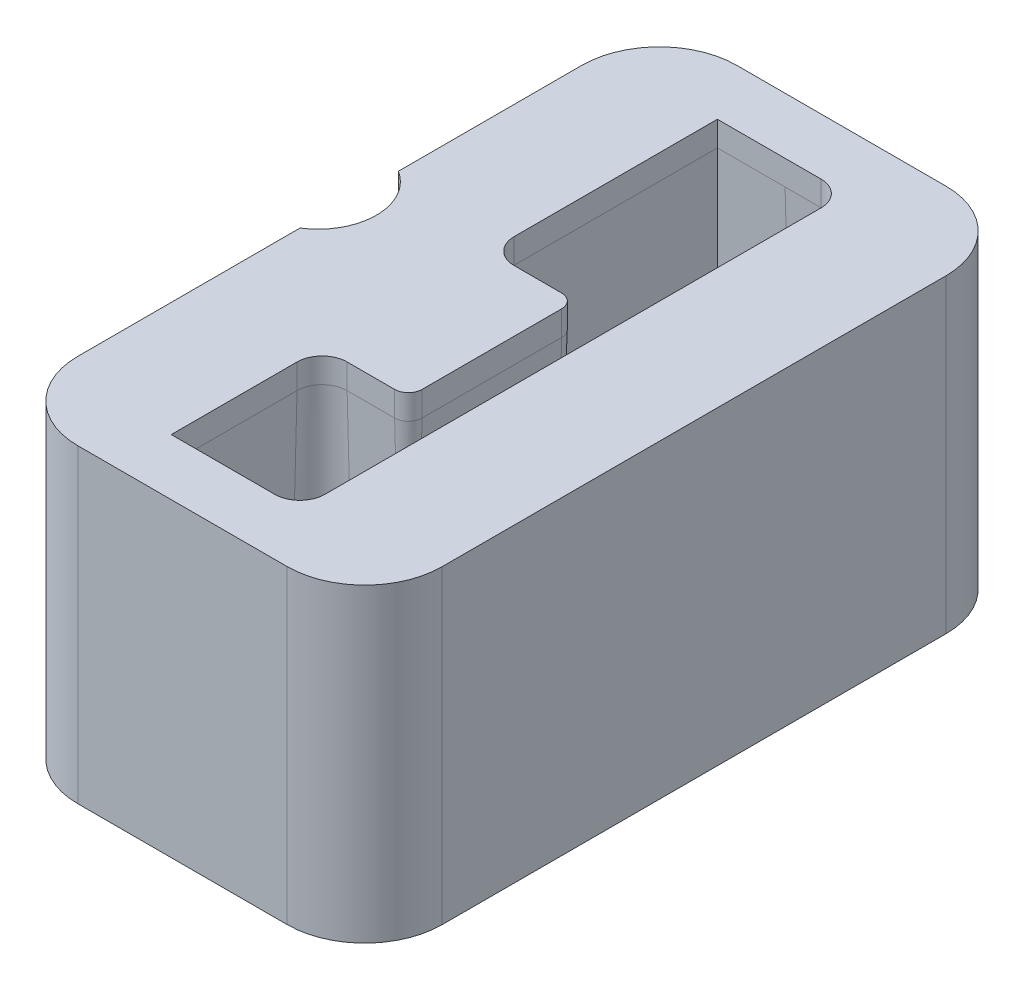
from build123d import *

# Parameters (mm, degrees)
SKETCH1_W                   = 47
SKETCH1_H                   = 85
BOSS_EXTRUDE1_DEPTH         = 40
FILLET1_R                   = 10
CUT_EXTRUDE1_REACH          = 64.917
M6_TAPPED_HOLE1_D           = 5
M6_TAPPED_HOLE1_DEPTH       = 17
M6_TAPPED_HOLE1_CSINK_D     = 6.05
M6_TAPPED_HOLE1_CSINK_ANGLE = 90
M6_TAPPED_HOLE1_TIP         = 1.502151548
SKETCH9_R                   = 7.5
CUT_EXTRUDE2_DEPTH          = 268.695101375
SKETCH10_R                  = 10
CUT_EXTRUDE3_DEPTH          = 30


with BuildPart() as part:
    # Sketch1 → Boss-Extrude1 (new body)
    with BuildSketch(Plane(origin=(0, 0, 0), x_dir=(1, 0, 0), z_dir=(0, 1, 0))):
        Rectangle(SKETCH1_W, SKETCH1_H)
    extrude(amount=-BOSS_EXTRUDE1_DEPTH)

    # Fillet1
    fillet1_edges = [part.edges().sort_by_distance(p)[0] for p in [
        (-23.5, -20, -42.5),
        (23.5, -20, -42.5),
        (-23.5, -20, 42.5),
        (23.5, -20, 42.5),
    ]]
    fillet(fillet1_edges, radius=FILLET1_R)

    # Sketch3 → Cut-Extrude1 (cut, up to next)
    with BuildSketch(Plane(origin=(0, 0, 0), x_dir=(1, 0, 0), z_dir=(0, 1, 0)), mode=Mode.PRIVATE) as cut_extrude1_sk1:
        with BuildLine():
            Line((4.63, 35.23), (-8.73, 35.23))
            Line((-8.73, 35.23), (-8.73, 9))
            ThreePointArc((-8.73, 9), (-7.783954903, 6.716045097), (-5.5, 5.77))
            Line((-5.5, 5.77), (0.63, 5.77))
            ThreePointArc((0.63, 5.77), (1.881579003, 5.251579003), (2.4, 4))
            Line((2.4, 4), (2.4, -14))
            ThreePointArc((2.4, -14), (1.881579003, -15.251579003), (0.63, -15.77))
            Line((0.63, -15.77), (-5.5, -15.77))
            ThreePointArc((-5.5, -15.77), (-7.783954903, -16.716045097), (-8.73, -19))
            Line((-8.73, -19), (-8.73, -35.23))
            Line((-8.73, -35.23), (4.63, -35.23))
            ThreePointArc((4.63, -35.23), (6.913954903, -34.283954903), (7.86, -32))
            Line((7.86, -32), (7.86, 32))
            ThreePointArc((7.86, 32), (6.913954903, 34.283954903), (4.63, 35.23))
        make_face()
    cut_extrude1_tool1 = extrude(cut_extrude1_sk1.sketch, amount=-CUT_EXTRUDE1_REACH, mode=Mode.PRIVATE) & part.part
    add(cut_extrude1_tool1.solids().sort_by_distance((6.402103, 0, -33.772103))[0], mode=Mode.SUBTRACT)

    # Cut-Sweep1: sweep along a path in Sketch5
    with BuildLine(Plane(origin=(0, 0, 0), x_dir=(1, 0, 0), z_dir=(0, 1, 0))) as cut_sweep1_path:
        Line((-8.73, -35.23), (4.63, -35.23))
        ThreePointArc((4.63, -35.23), (6.913954903, -34.283954903), (7.86, -32))
        Line((7.86, -32), (7.86, 32))
        ThreePointArc((7.86, 32), (6.913954903, 34.283954903), (4.63, 35.23))
        Line((4.63, 35.23), (-8.73, 35.23))
        Line((-8.73, 35.23), (-8.73, 9))
        ThreePointArc((-8.73, 9), (-7.783954903, 6.716045097), (-5.5, 5.77))
        Line((-5.5, 5.77), (0.63, 5.77))
        ThreePointArc((0.63, 5.77), (1.881579003, 5.251579003), (2.4, 4))
        Line((2.4, 4), (2.4, -14))
        ThreePointArc((2.4, -14), (1.881579003, -15.251579003), (0.63, -15.77))
        Line((0.63, -15.77), (-5.5, -15.77))
        ThreePointArc((-5.5, -15.77), (-7.783954903, -16.716045097), (-8.73, -19))
        Line((-8.73, -19), (-8.73, -35.23))
    # Sketch4 → Cut-Sweep1 (sweep, cut)
    with BuildSketch(Plane(origin=(0, 0, 0), x_dir=(0, 0, -1), z_dir=(1, 0, 0))):
        Polygon((35.23, -3.2), (36.193641914, -40), (35.23, -40), align=None)
    sweep(path=cut_sweep1_path.line, transition=Transition.RIGHT, mode=Mode.SUBTRACT)

    # M6 Tapped Hole1
    with Locations(Plane(origin=(0, -40, 0), x_dir=(-1, 0, 0), z_dir=(0, -1, 0))):
        with Locations((-16.5, 35.5), (16.5, 35.5), (16.5, -35.5), (-16.5, -35.5)):
            CounterSinkHole(M6_TAPPED_HOLE1_D / 2, M6_TAPPED_HOLE1_CSINK_D / 2, depth=M6_TAPPED_HOLE1_DEPTH, counter_sink_angle=M6_TAPPED_HOLE1_CSINK_ANGLE)
            with Locations((0, 0, -(M6_TAPPED_HOLE1_DEPTH + M6_TAPPED_HOLE1_TIP / 2))):  # 118° drill point
                Cone(0, M6_TAPPED_HOLE1_D / 2, M6_TAPPED_HOLE1_TIP, mode=Mode.SUBTRACT)

    # Sketch9 → Cut-Extrude2 (cut, through all)
    with BuildSketch(Plane(origin=(236.38, 0, 7.73), x_dir=(1, 0, 0), z_dir=(0, 1, 0))):
        with Locations((-263.88, 10.23)):
            Circle(SKETCH9_R)
    extrude(amount=-CUT_EXTRUDE2_DEPTH, mode=Mode.SUBTRACT)

    # Sketch10 → Cut-Extrude3 (cut)
    with BuildSketch(Plane(origin=(236.38, -40, 7.73), x_dir=(1, 0, 0), z_dir=(0, -1, 0))):
        with Locations((-263.88, -10.23)):
            Circle(SKETCH10_R)
    extrude(amount=-CUT_EXTRUDE3_DEPTH, mode=Mode.SUBTRACT)


solid = part.part
